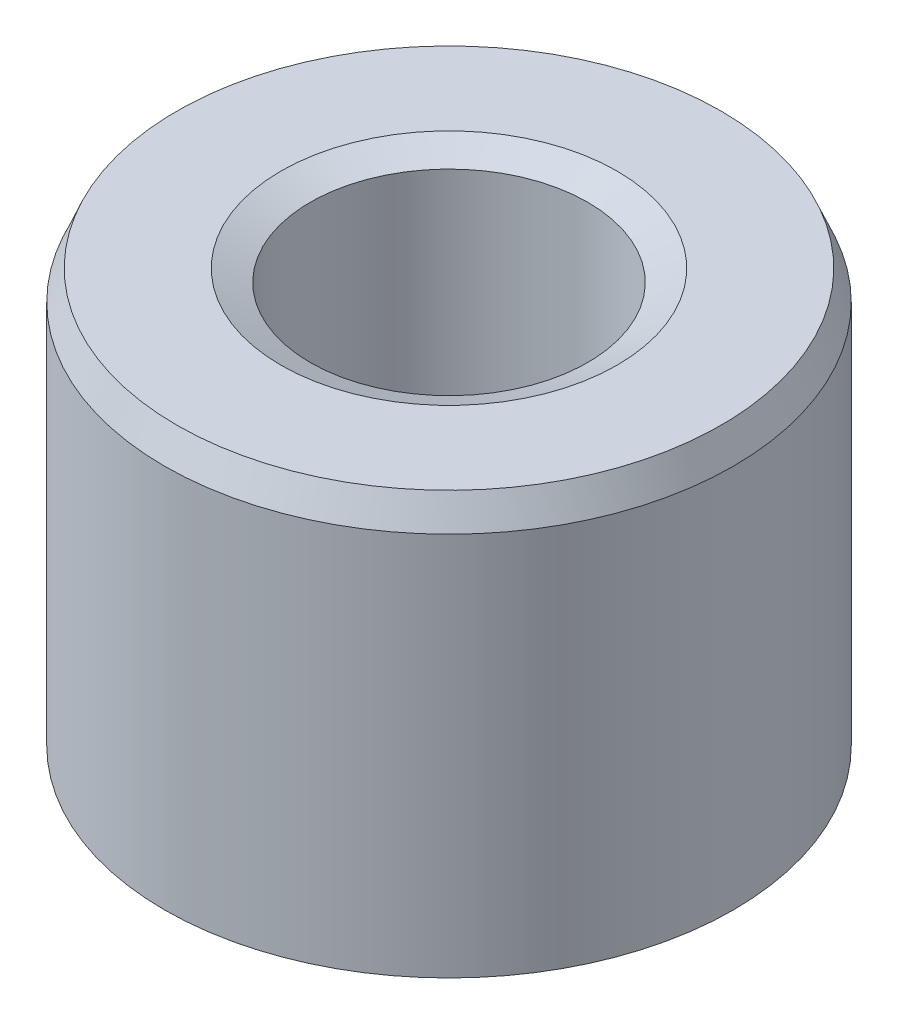
from build123d import *
from OCP.BRepFilletAPI import BRepFilletAPI_MakeChamfer

# Parameters (mm, degrees)
SKETCH1_R           = 32.5
BOSS_EXTRUDE1_DEPTH = 48.672336952
SKETCH2_R           = 15.859656817
CUT_EXTRUDE1_DEPTH  = 67.943979448
CHAMFER1_SIZE       = 3.349817993
CHAMFER1_SIZE2      = 1.409360628


with BuildPart() as part:
    # Sketch1 → Boss-Extrude1 (new body)
    with BuildSketch(Plane(origin=(0, 0, 0), x_dir=(1, 0, 0), z_dir=(0, 1, 0))):
        Circle(SKETCH1_R)
    extrude(amount=BOSS_EXTRUDE1_DEPTH)

    # Sketch2 → Cut-Extrude1 (cut, through all)
    with BuildSketch(Plane(origin=(0, 0, 0), x_dir=(1, 0, 0), z_dir=(0, 1, 0))):
        Circle(SKETCH2_R)
    extrude(amount=CUT_EXTRUDE1_DEPTH, mode=Mode.SUBTRACT)

    # Chamfer1: one chamfer whose edges measure the first distance from different faces: ONE call of the kernel's chamfer builder (chamfer() names one face for all edges)
    chamfer1_edges_1 = [part.edges().sort_by_distance(p)[0] for p in [
        (-15.859656817, 48.672336952, 0),
    ]]
    chamfer1_side_1 = [part.faces().sort_by_distance(p)[0] for p in [
        (-31.580761184, 48.672336952, 0),
    ]]
    chamfer1_edges_2 = [part.edges().sort_by_distance(p)[0] for p in [
        (-15.859656817, 0, 0),
    ]]
    chamfer1_side_2 = [part.faces().sort_by_distance(p)[0] for p in [
        (-15.859656817, 24.336168476, 0),
    ]]
    chamfer1_edges_3 = [part.edges().sort_by_distance(p)[0] for p in [
        (-32.5, 0, 0),
    ]]
    chamfer1_side_3 = [part.faces().sort_by_distance(p)[0] for p in [
        (-31.580761184, 0, 0),
    ]]
    chamfer1_edges_4 = [part.edges().sort_by_distance(p)[0] for p in [
        (-32.5, 48.672336952, 0),
    ]]
    chamfer1_side_4 = [part.faces().sort_by_distance(p)[0] for p in [
        (-32.5, 24.336168476, 0),
    ]]
    chamfer1 = BRepFilletAPI_MakeChamfer(part.part.solid().wrapped)
    for e in chamfer1_edges_1:
        chamfer1.Add(CHAMFER1_SIZE, CHAMFER1_SIZE2, e.wrapped, chamfer1_side_1[0].wrapped)  # the first distance lies on this face
    for e in chamfer1_edges_2:
        chamfer1.Add(CHAMFER1_SIZE, CHAMFER1_SIZE2, e.wrapped, chamfer1_side_2[0].wrapped)  # the first distance lies on this face
    for e in chamfer1_edges_3:
        chamfer1.Add(CHAMFER1_SIZE, CHAMFER1_SIZE2, e.wrapped, chamfer1_side_3[0].wrapped)  # the first distance lies on this face
    for e in chamfer1_edges_4:
        chamfer1.Add(CHAMFER1_SIZE, CHAMFER1_SIZE2, e.wrapped, chamfer1_side_4[0].wrapped)  # the first distance lies on this face
    add(Compound.cast(chamfer1.Shape()), mode=Mode.REPLACE)


solid = part.part
